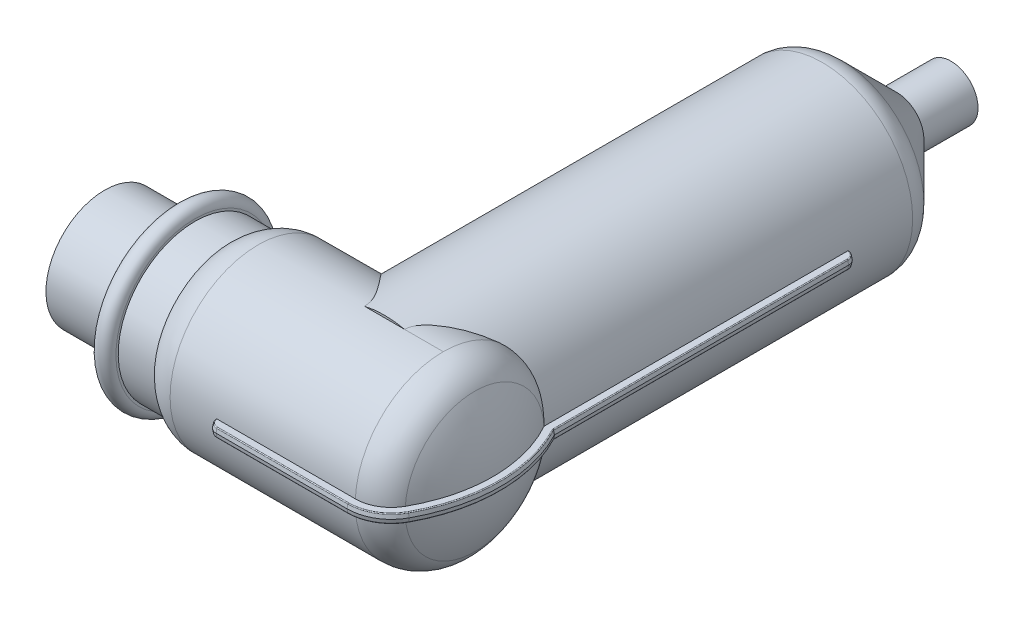
from build123d import *

# Parameters (mm, degrees)
BOSS_EXTRUDE1_DEPTH                     = 0.5
BOSS_EXTRUDE1_DRAFT                     = 10
BOSS_EXTRUDE1_PROFILE_2_DEPTH           = 0.5
BOSS_EXTRUDE1_PROFILE_2_DRAFT           = 10
BOSS_EXTRUDE1_OTHER_WAY_DEPTH           = 0.5
BOSS_EXTRUDE1_OTHER_WAY_DRAFT           = -10
BOSS_EXTRUDE1_OTHER_WAY_PROFILE_2_DEPTH = 0.5
BOSS_EXTRUDE1_OTHER_WAY_PROFILE_2_DRAFT = -10
FILLET1_R                               = 0.1


with BuildPart() as part:
    # Sketch1 → Revolve1 (revolve)
    with BuildSketch(Plane.XY):
        with BuildLine():
            Line((8, 6.5), (8, 8.75))
            ThreePointArc((8, 8.75), (9, 9.75), (10, 8.75))
            Line((10, 8.75), (10, 8.5))
            Line((10, 8.5), (14, 8.5))
            ThreePointArc((14, 8.5), (15.375, 9.425), (17, 9.75))
            Line((17, 9.75), (37.5, 9.75))
            ThreePointArc((37.5, 9.75), (39.522877999, 9.20079188), (40.990265487, 7.703982301))
            ThreePointArc((40.990265487, 7.703982301), (42.4892974, 3.98090367), (43, 0))
            Line((43, 0), (0, 0))
            Line((0, 0), (0, 6.5))
            Line((0, 6.5), (8, 6.5))
        make_face()
    revolve(axis=Axis((0, 0, 0), (-1, 0, 0)))

    # Sketch2 → Revolve2 (revolve)
    with BuildSketch(Plane(origin=(0, 0, 0), x_dir=(1, 0, 0), z_dir=(0, 1, 0))):
        with BuildLine():
            Line((41, 0), (31, 0))
            Line((31, 0), (31, 62.742640687))
            Line((31, 62.742640687), (34, 62.742640687))
            Line((34, 62.742640687), (34, 56.742640687))
            Line((34, 56.742640687), (40.121320344, 50.621320344))
            ThreePointArc((40.121320344, 50.621320344), (40.771638598, 49.648050297), (41, 48.5))
            Line((41, 48.5), (41, 0))
        make_face()
    revolve(axis=Axis((31, 0, 0), (0, 0, 1)))


with BuildPart() as boss_extrude1_tool:
    # Sketch3 → Boss-Extrude1 (with draft: the straight prism first)
    with BuildSketch(Plane(origin=(0, 0, 0), x_dir=(1, 0, 0), z_dir=(0, 1, 0))):
        with BuildLine():
            ThreePointArc((40.9, 7.660954701), (42.867294577, 0.024062034), (40.923123345, -7.61875))
            ThreePointArc((40.923123345, -7.61875), (39.490210416, -9.103962209), (37.5, -9.65))
            Line((37.5, -9.65), (22, -9.65))
            ThreePointArc((22, -9.65), (22.292893219, -10.357106781), (23, -10.65))
            Line((23, -10.65), (37.5, -10.65))
            ThreePointArc((37.5, -10.65), (40.000520779, -9.963952519), (41.80084728, -8.097916667))
            ThreePointArc((41.80084728, -8.097916667), (43.866988751, -0.104652812), (41.9, 7.913586576))
            Line((41.9, 7.913586576), (41.9, 40.5))
            ThreePointArc((41.9, 40.5), (41.607106781, 41.207106781), (40.9, 41.5))
            Line((40.9, 41.5), (40.9, 7.660954701))
        make_face()
    extrude(amount=BOSS_EXTRUDE1_DEPTH)
    # Boss-Extrude1: the draft: its side faces are tilted about the plane it starts from
    boss_extrude1_sides = [boss_extrude1_tool.faces().sort_by_distance(p)[0] for p in [
        (42.867294577, 0.25, -0.024062034),
        (39.490210416, 0.25, 9.103962209),
        (29.75, 0.25, 9.65),
        (22.292893219, 0.25, 10.357106781),
        (30.25, 0.25, 10.65),
        (40.000520779, 0.25, 9.963952519),
        (43.866988751, 0.25, 0.104652812),
        (41.9, 0.25, -24.206793288),
        (41.607106781, 0.25, -41.207106781),
        (40.9, 0.25, -24.58047735),
    ]]
    draft(boss_extrude1_sides, Plane(origin=(0, 0, 0), x_dir=(1, 0, 0), z_dir=(0, 1, 0)), BOSS_EXTRUDE1_DRAFT)


with BuildPart() as part_1:
    add(part.part)

    # Boss-Extrude1: add boss_extrude1_tool
    add(boss_extrude1_tool.part)


with BuildPart() as boss_extrude1_profile_2_tool:
    # Sketch3 → Boss-Extrude1 profile 2 (with draft: the straight prism first)
    with BuildSketch(Plane(origin=(0, 0, 0), x_dir=(1, 0, 0), z_dir=(0, 1, 0))):
        with BuildLine():
            Line((21.1, 9.65), (21.1, 41.5))
            ThreePointArc((21.1, 41.5), (20.392893219, 41.207106781), (20.1, 40.5))
            Line((20.1, 40.5), (20.1, 10.65))
            Line((20.1, 10.65), (20, 10.65))
            ThreePointArc((20, 10.65), (19.292893219, 10.357106781), (19, 9.65))
            Line((19, 9.65), (21.1, 9.65))
        make_face()
    extrude(amount=BOSS_EXTRUDE1_PROFILE_2_DEPTH)
    # Boss-Extrude1 profile 2: the draft: its side faces are tilted about the plane it starts from
    boss_extrude1_profile_2_sides = [boss_extrude1_profile_2_tool.faces().sort_by_distance(p)[0] for p in [
        (21.1, 0.25, -25.575),
        (20.392893219, 0.25, -41.207106781),
        (20.1, 0.25, -25.575),
        (20.05, 0.25, -10.65),
        (19.292893219, 0.25, -10.357106781),
        (20.05, 0.25, -9.65),
    ]]
    draft(boss_extrude1_profile_2_sides, Plane(origin=(0, 0, 0), x_dir=(1, 0, 0), z_dir=(0, 1, 0)), BOSS_EXTRUDE1_PROFILE_2_DRAFT)


with BuildPart() as part_2:
    add(part_1.part)

    # Boss-Extrude1 profile 2: add boss_extrude1_profile_2_tool
    add(boss_extrude1_profile_2_tool.part)


with BuildPart() as boss_extrude1_other_way_tool:
    # Sketch3 → Boss-Extrude1 other way (with draft: the straight prism first)
    with BuildSketch(Plane(origin=(0, 0, 0), x_dir=(1, 0, 0), z_dir=(0, 1, 0))):
        with BuildLine():
            ThreePointArc((40.9, 7.660954701), (42.867294577, 0.024062034), (40.923123345, -7.61875))
            ThreePointArc((40.923123345, -7.61875), (39.490210416, -9.103962209), (37.5, -9.65))
            Line((37.5, -9.65), (22, -9.65))
            ThreePointArc((22, -9.65), (22.292893219, -10.357106781), (23, -10.65))
            Line((23, -10.65), (37.5, -10.65))
            ThreePointArc((37.5, -10.65), (40.000520779, -9.963952519), (41.80084728, -8.097916667))
            ThreePointArc((41.80084728, -8.097916667), (43.866988751, -0.104652812), (41.9, 7.913586576))
            Line((41.9, 7.913586576), (41.9, 40.5))
            ThreePointArc((41.9, 40.5), (41.607106781, 41.207106781), (40.9, 41.5))
            Line((40.9, 41.5), (40.9, 7.660954701))
        make_face()
    extrude(amount=-BOSS_EXTRUDE1_OTHER_WAY_DEPTH)
    # Boss-Extrude1 other way: the draft: its side faces are tilted about the plane it starts from
    boss_extrude1_other_way_sides = [boss_extrude1_other_way_tool.faces().sort_by_distance(p)[0] for p in [
        (42.867294577, -0.25, -0.024062034),
        (39.490210416, -0.25, 9.103962209),
        (29.75, -0.25, 9.65),
        (22.292893219, -0.25, 10.357106781),
        (30.25, -0.25, 10.65),
        (40.000520779, -0.25, 9.963952519),
        (43.866988751, -0.25, 0.104652812),
        (41.9, -0.25, -24.206793288),
        (41.607106781, -0.25, -41.207106781),
        (40.9, -0.25, -24.58047735),
    ]]
    draft(boss_extrude1_other_way_sides, Plane(origin=(0, 0, 0), x_dir=(1, 0, 0), z_dir=(0, 1, 0)), BOSS_EXTRUDE1_OTHER_WAY_DRAFT)


with BuildPart() as part_3:
    add(part_2.part)

    # Boss-Extrude1 other way: add boss_extrude1_other_way_tool
    add(boss_extrude1_other_way_tool.part)


with BuildPart() as boss_extrude1_other_way_profile_2_tool:
    # Sketch3 → Boss-Extrude1 other way profile 2 (with draft: the straight prism first)
    with BuildSketch(Plane(origin=(0, 0, 0), x_dir=(1, 0, 0), z_dir=(0, 1, 0))):
        with BuildLine():
            Line((21.1, 9.65), (21.1, 41.5))
            ThreePointArc((21.1, 41.5), (20.392893219, 41.207106781), (20.1, 40.5))
            Line((20.1, 40.5), (20.1, 10.65))
            Line((20.1, 10.65), (20, 10.65))
            ThreePointArc((20, 10.65), (19.292893219, 10.357106781), (19, 9.65))
            Line((19, 9.65), (21.1, 9.65))
        make_face()
    extrude(amount=-BOSS_EXTRUDE1_OTHER_WAY_PROFILE_2_DEPTH)
    # Boss-Extrude1 other way profile 2: the draft: its side faces are tilted about the plane it starts from
    boss_extrude1_other_way_profile_2_sides = [boss_extrude1_other_way_profile_2_tool.faces().sort_by_distance(p)[0] for p in [
        (21.1, -0.25, -25.575),
        (20.392893219, -0.25, -41.207106781),
        (20.1, -0.25, -25.575),
        (20.05, -0.25, -10.65),
        (19.292893219, -0.25, -10.357106781),
        (20.05, -0.25, -9.65),
    ]]
    draft(boss_extrude1_other_way_profile_2_sides, Plane(origin=(0, 0, 0), x_dir=(1, 0, 0), z_dir=(0, 1, 0)), BOSS_EXTRUDE1_OTHER_WAY_PROFILE_2_DRAFT)


with BuildPart() as part_4:
    add(part_3.part)

    # Boss-Extrude1 other way profile 2: add boss_extrude1_other_way_profile_2_tool
    add(boss_extrude1_other_way_profile_2_tool.part)

    # Fillet1
    fillet1_edges = [part_4.edges().sort_by_distance(p)[0] for p in [
        (20.424782809, 0.5, -41.11280304),
        (20.424782809, -0.5, -41.11280304),
        (20.18816349, 0.5, -25.530918255),
        (20.18816349, -0.5, -25.530918255),
        (19.38719696, -0.5, -10.325217191),
        (20.094081745, 0.5, -10.56183651),
        (41.575217191, 0.5, -41.11280304),
        (22.38719696, 0.5, 10.325217191),
        (30.25, 0.5, 10.56183651),
        (39.955530036, 0.5, 9.888132772),
        (41.575217191, -0.5, -41.11280304),
        (43.778891166, -0.5, 0.093161799),
        (39.955530036, -0.5, 9.888132772),
        (30.25, -0.5, 10.56183651),
        (41.855918198, -0.250000324, -7.902620269),
        (41.855918198, 0.250000324, -7.902620269),
        (20.094081745, -0.5, -10.56183651),
        (20.144081745, -0.25, -10.605918255),
        (20.144081745, 0.25, -10.605918255),
        (19.38719696, 0.5, -10.325217191),
        (41.81183651, 0.5, -24.195819375),
        (43.778891166, 0.5, 0.093161799),
        (41.81183651, -0.5, -24.195819375),
        (22.38719696, -0.5, 10.325217191),
    ]]
    fillet(fillet1_edges, radius=FILLET1_R)


solid = part_4.part
